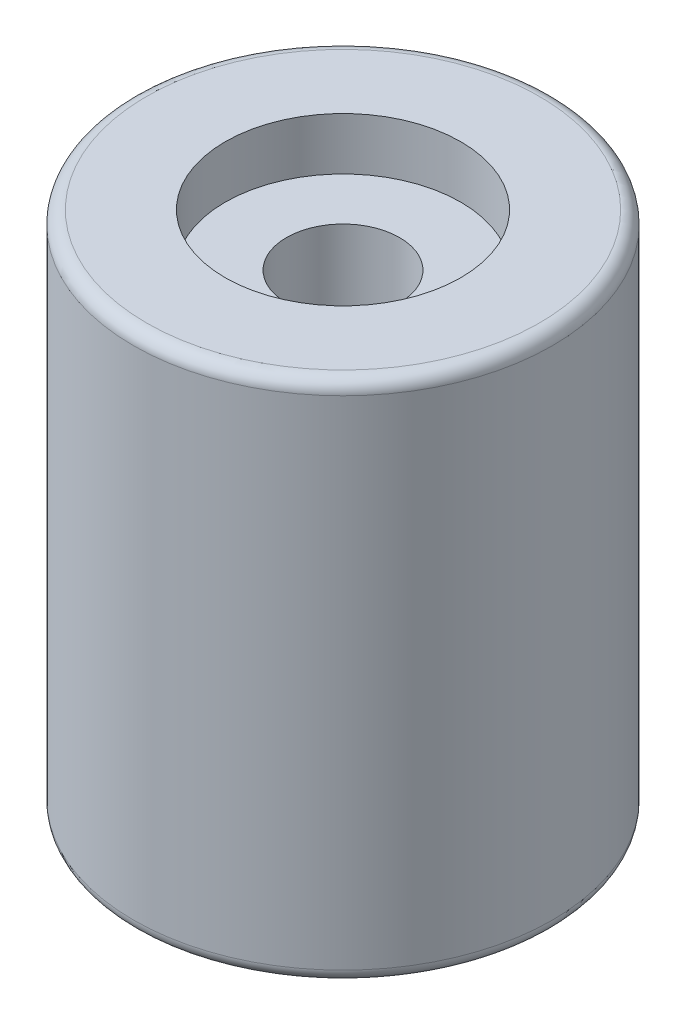
from build123d import *

# Parameters (mm, degrees)
SKETCH1_R               = 25.4
BOSS_EXTRUDE1_DEPTH     = 63.5
FILLET1_R               = 1.5875
SKETCH2_R               = 14.2875
CUT_EXTRUDE1_DEPTH      = 6.35
CUT_EXTRUDE2_START      = -6.35
SKETCH3_R               = 14.2875
CUT_EXTRUDE2_DEPTH      = 6.35
CUT_EXTRUDE3_DEPTH      = 68.501425948
CUT_EXTRUDE3_DEPTH_BACK = 68.501425948
SKETCH4_R               = 6.858


with BuildPart() as part:
    # Sketch1 → Boss-Extrude1 (new body)
    with BuildSketch(Plane(origin=(0, 0, 0), x_dir=(1, 0, 0), z_dir=(0, 1, 0))):
        Circle(SKETCH1_R)
    extrude(amount=BOSS_EXTRUDE1_DEPTH)

    # Fillet1
    fillet1_edges = [part.edges().sort_by_distance(p)[0] for p in [
        (-25.4, 0, 0),
        (-25.4, 63.5, 0),
    ]]
    fillet(fillet1_edges, radius=FILLET1_R)

    # Sketch2 → Cut-Extrude1 (cut)
    with BuildSketch(Plane(origin=(0, 63.5, 0), x_dir=(1, 0, 0), z_dir=(0, 1, 0))):
        Circle(SKETCH2_R)
    extrude(amount=-CUT_EXTRUDE1_DEPTH, mode=Mode.SUBTRACT)

    # Sketch3 → Cut-Extrude2 (cut)
    with BuildSketch(Plane.XZ.offset(CUT_EXTRUDE2_START)):
        Circle(SKETCH3_R)
    extrude(amount=CUT_EXTRUDE2_DEPTH, mode=Mode.SUBTRACT)

    # Sketch4 → Cut-Extrude3 (cut, two sides: drawn at the far end of the back side and taken through both)
    with BuildSketch(Plane.XZ.offset(-6.35).offset(-CUT_EXTRUDE3_DEPTH_BACK)):
        Circle(SKETCH4_R)
    extrude(amount=CUT_EXTRUDE3_DEPTH + CUT_EXTRUDE3_DEPTH_BACK, mode=Mode.SUBTRACT)


solid = part.part
